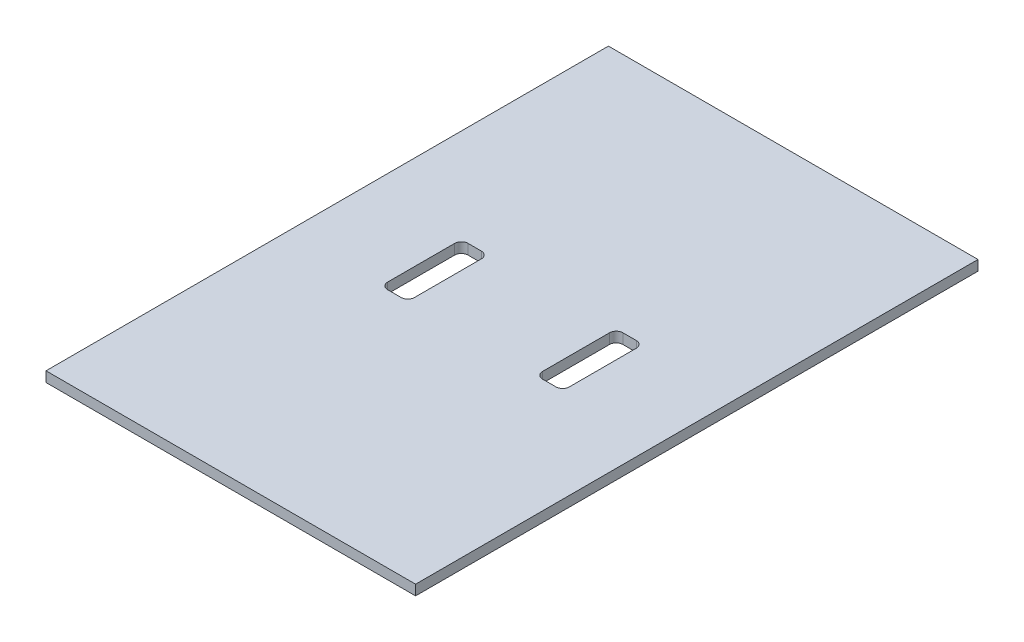
from build123d import *

# Parameters (mm, degrees)
SKETCH1_W           = 175.26
SKETCH1_H           = 266.7
BOSS_EXTRUDE1_DEPTH = 4.826
SKETCH2_W           = 12.7
SKETCH2_H           = 38.1
CUT_EXTRUDE1_DEPTH  = 160.638747414
FILLET1_R           = 3.175


with BuildPart() as part:
    # Sketch1 → Boss-Extrude1 (new body)
    with BuildSketch(Plane(origin=(0, 0, 0), x_dir=(1, 0, 0), z_dir=(0, 1, 0))):
        Rectangle(SKETCH1_W, SKETCH1_H)
    extrude(amount=BOSS_EXTRUDE1_DEPTH)

    # Sketch2 → Cut-Extrude1 (cut, through all)
    with BuildSketch(Plane(origin=(0, 4.826, 0), x_dir=(1, 0, 0), z_dir=(0, 1, 0))):
        with Locations((-36.7165001, 0)):
            Rectangle(SKETCH2_W, SKETCH2_H)
    cut_extrude1 = extrude(amount=-CUT_EXTRUDE1_DEPTH, mode=Mode.SUBTRACT)

    # Mirror1: Cut-Extrude1 across plane
    add(cut_extrude1.mirror(Plane(origin=(0, 0, 0), x_dir=(0, 0, 1), z_dir=(1, 0, 0))), mode=Mode.SUBTRACT)

    # Fillet1
    fillet1_edges = [part.edges().sort_by_distance(p)[0] for p in [
        (43.0665001, 2.413, 19.05),
        (30.3665001, 2.413, 19.05),
        (43.0665001, 2.413, -19.05),
        (30.3665001, 2.413, -19.05),
        (-30.3665001, 2.413, 19.05),
        (-43.0665001, 2.413, 19.05),
        (-30.3665001, 2.413, -19.05),
        (-43.0665001, 2.413, -19.05),
    ]]
    fillet(fillet1_edges, radius=FILLET1_R)


solid = part.part
